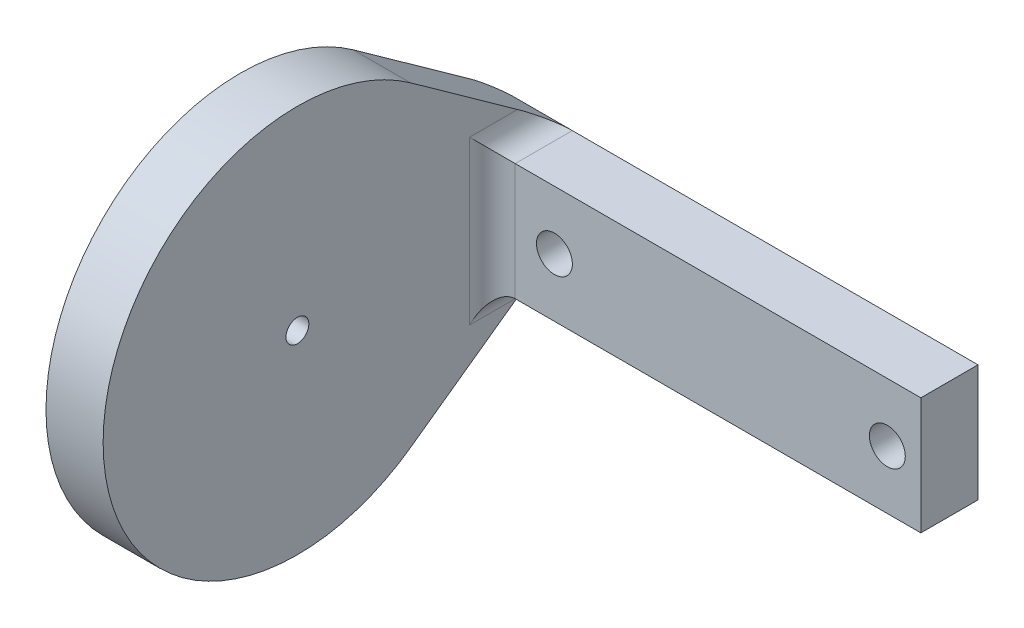
from build123d import *

# Parameters (mm, degrees)
SKETCH1_W           = 47.625
SKETCH1_H           = 13.0048
SKETCH1_R           = 1.9939
BOSS_EXTRUDE1_DEPTH = 6.35
SKETCH2_W           = 6.35
SKETCH2_H           = 13.0048
BOSS_EXTRUDE2_DEPTH = 38.1
SKETCH3_R           = 1.27
CUT_EXTRUDE1_DEPTH  = 50.8
BOSS_EXTRUDE3_DEPTH = 6.35
SKETCH5_R           = 1.27
CUT_EXTRUDE2_DEPTH  = 73.076652277
FILLET1_R           = 2.54


with BuildPart() as part:
    # Sketch1 → Boss-Extrude1 (new body)
    with BuildSketch(Plane.XY):
        with Locations((-1.5875, 0)):
            Rectangle(SKETCH1_W, SKETCH1_H)
        with Locations((-18.5, 0)):
            Circle(SKETCH1_R, mode=Mode.SUBTRACT)
        with Locations((18.5, 0)):
            Circle(SKETCH1_R, mode=Mode.SUBTRACT)
    extrude(amount=BOSS_EXTRUDE1_DEPTH)

    # Sketch2 → Boss-Extrude2 (add)
    with BuildSketch(Plane.XY):
        with Locations((-28.575, 0)):
            Rectangle(SKETCH2_W, SKETCH2_H)
    extrude(amount=BOSS_EXTRUDE2_DEPTH)

    # Sketch3 → Cut-Extrude1 (cut)
    with BuildSketch(Plane(origin=(-25.4, 0, 0), x_dir=(0, 0, -1), z_dir=(1, 0, 0))):
        with Locations((-28.0162, 0)):
            Circle(SKETCH3_R)
    extrude(amount=-CUT_EXTRUDE1_DEPTH, mode=Mode.SUBTRACT)

    # Sketch4 → Boss-Extrude3 (add)
    with BuildSketch(Plane.ZY.offset(31.75)):
        with BuildLine():
            Line((0, 6.5024), (15.453691327, 17.558800524))
            ThreePointArc((15.453691327, 17.558800524), (49.6062, 0), (15.453691327, -17.558800524))
            Line((15.453691327, -17.558800524), (0, -6.5024))
            Line((0, -6.5024), (0, 6.5024))
        make_face()
    extrude(amount=-BOSS_EXTRUDE3_DEPTH)

    # Sketch5 → Cut-Extrude2 (cut, through all)
    with BuildSketch(Plane(origin=(-25.4, 0, 0), x_dir=(0, 0, -1), z_dir=(1, 0, 0))):
        with Locations((-28.0162, 0)):
            Circle(SKETCH5_R)
    extrude(amount=-CUT_EXTRUDE2_DEPTH, mode=Mode.SUBTRACT)

    # Fillet1
    fillet1_edges = [part.edges().sort_by_distance(p)[0] for p in [
        (-31.75, 0, 0),
        (-25.4, -6.5024, 3.175),
        (-25.4, 6.5024, 3.175),
        (-25.4, 0, 6.35),
    ]]
    fillet(fillet1_edges, radius=FILLET1_R)


solid = part.part
